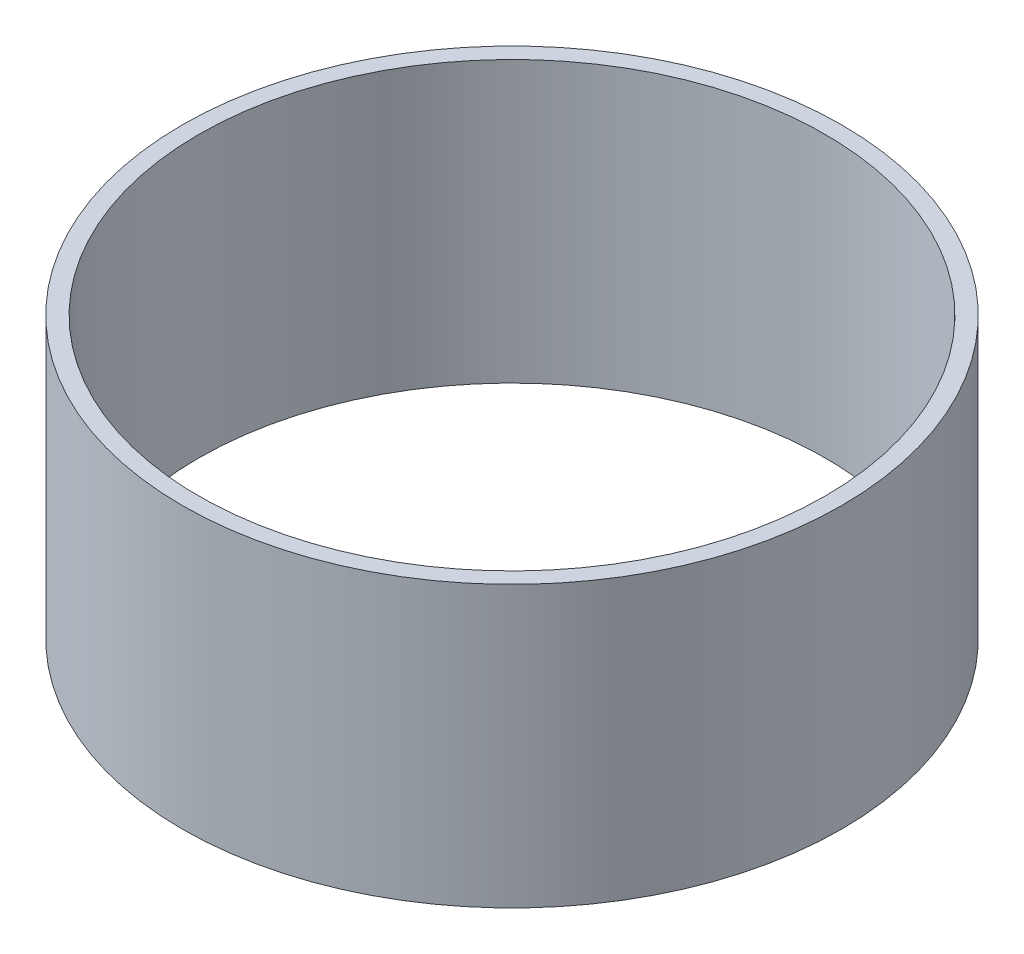
from build123d import *

# Parameters (mm, degrees)
SKETCH1_R           = 60
SKETCH1_R_2         = 57
EXTRUDE_THIN1_DEPTH = 51


with BuildPart() as part:
    # Sketch1 → Extrude-Thin1 (new body)
    with BuildSketch(Plane(origin=(0, 0, 0), x_dir=(1, 0, 0), z_dir=(0, 1, 0))):
        Circle(SKETCH1_R)
        Circle(SKETCH1_R_2, mode=Mode.SUBTRACT)
    extrude(amount=EXTRUDE_THIN1_DEPTH)


solid = part.part
